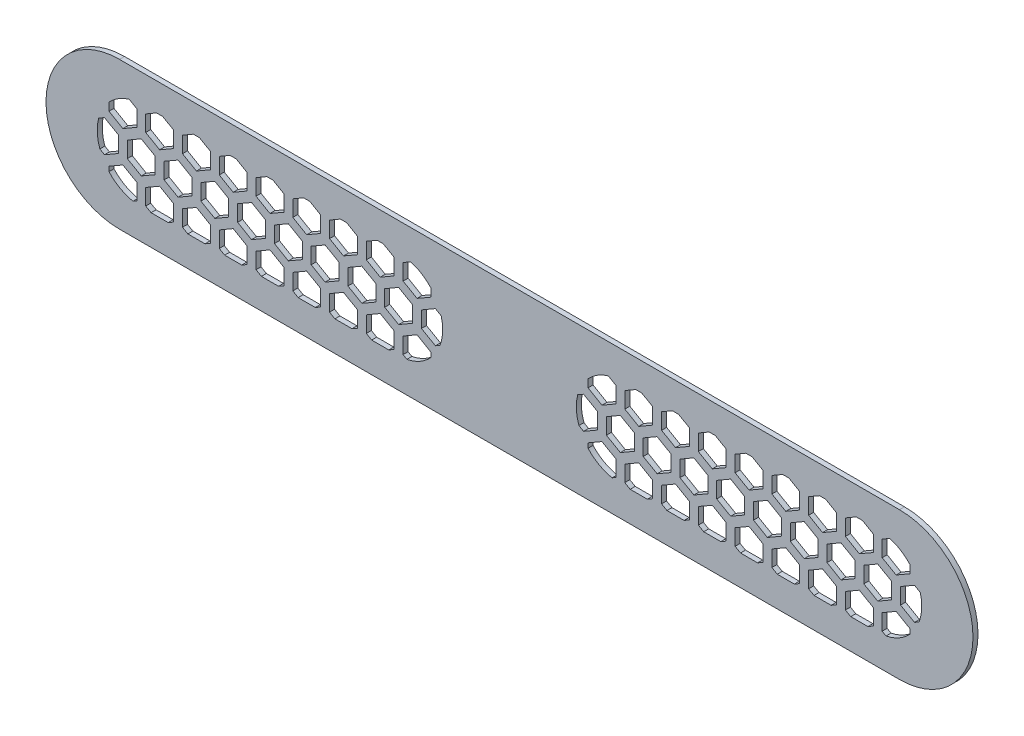
from build123d import *

# Parameters (mm, degrees)
AUFSATZ_LINEAR_AUSTRAGEN1_DEPTH    = 0.45
K_RPER_VERSCHIEBEN_KOPIEREN1_DEPTH = 0.45
SCHNITT_LINEAR_AUSTRAGEN1_DEPTH    = 51.428290671
LINEARES_MUSTER1_COUNT             = 13
LINEARES_MUSTER1_PITCH             = 3.3
LINEARES_MUSTER1_COUNT_DIR2        = 11
LINEARES_MUSTER1_PITCH_DIR2        = 3.3
SKIZZE4_OUTSIDE_W                  = 52.33
SKIZZE4_OUTSIDE_H                  = 23.93
SCHNITT_LINEAR_AUSTRAGEN2_DEPTH    = 51.428290671
SCHNITT_LINEAR_AUSTRAGEN3_DEPTH    = 51.428290671


# Read off the part's stored shape, not the designer's step: Körper-Verschieben/Kopieren1
with BuildPart() as part:
    # Skizze2 → Aufsatz-Linear austragen1 (new body)
    with BuildSketch(Plane.XY):
        with BuildLine():
            Line((0, 15.3), (35, 15.3))
            ThreePointArc((35, 15.3), (41.6, 21.9), (35, 28.5))
            Line((35, 28.5), (0, 28.5))
            Line((0, 28.5), (0, 15.3))
        make_face()
    extrude(amount=AUFSATZ_LINEAR_AUSTRAGEN1_DEPTH)

    # Skizze3 → Schnitt-Linear austragen1 (cut, through all)
    with BuildSketch(Plane.XY):
        Polygon((5, 20.443375673), (3.75, 19.721687836), (3.75, 18.278312164), (5, 17.556624327), (6.25, 18.278312164), (6.25, 19.721687836), align=None)
    schnitt_linear_austragen1 = extrude(amount=SCHNITT_LINEAR_AUSTRAGEN1_DEPTH, mode=Mode.SUBTRACT)

    # Lineares Muster1: Schnitt-Linear austragen1 13 × 11
    with Locations(*[Vector(0.49999999999999906, 0.8660254037844393, 0) * (i * LINEARES_MUSTER1_PITCH) + Vector(0.5000000000000003, -0.8660254037844386, 0) * (j * LINEARES_MUSTER1_PITCH_DIR2) for i in range(LINEARES_MUSTER1_COUNT) for j in range(LINEARES_MUSTER1_COUNT_DIR2) if (i, j) != (0, 0)]):
        add(schnitt_linear_austragen1, mode=Mode.SUBTRACT)

    # Skizze4 outside → Schnitt-Linear austragen2 (cut, through all)
    with BuildSketch(Plane.XY):
        with Locations((20.8, 21.9)):
            Rectangle(SKIZZE4_OUTSIDE_W, SKIZZE4_OUTSIDE_H)
        with BuildLine():
            Line((33, 18), (10, 18))
            ThreePointArc((10, 18), (6, 22), (10, 26))
            Line((10, 26), (33, 26))
            ThreePointArc((33, 26), (37, 22), (33, 18))
        make_face(mode=Mode.SUBTRACT)
    extrude(amount=SCHNITT_LINEAR_AUSTRAGEN2_DEPTH, mode=Mode.SUBTRACT)


with BuildPart() as body_2:
    # Körper-Verschieben/Kopieren1 outline → Körper-Verschieben/Kopieren1 (new body)
    with BuildSketch(Plane.XY):
        with BuildLine():
            Line((35, 28.5), (0, 28.5))
            Line((0, 28.5), (0, 15.3))
            Line((0, 15.3), (35, 15.3))
            ThreePointArc((35, 15.3), (41.6, 21.9), (35, 28.5))
        make_face()
    extrude(amount=K_RPER_VERSCHIEBEN_KOPIEREN1_DEPTH)

    # Skizze4<2> → Schnitt-Linear austragen3 (cut, through all)
    with BuildSketch(Plane.XY):
        with BuildLine():
            Line((33, 18), (10, 18))
            ThreePointArc((10, 18), (6, 22), (10, 26))
            Line((10, 26), (33, 26))
            ThreePointArc((33, 26), (37, 22), (33, 18))
        make_face()
    extrude(amount=SCHNITT_LINEAR_AUSTRAGEN3_DEPTH, mode=Mode.SUBTRACT)


with BuildPart() as part_1:
    add(part.part)

    # Kombinieren1: union body 2
    add(body_2.part)

    # Spiegeln2: part across plane


with BuildPart() as part_2:
    add(part_1.part)
    add(part_1.part.mirror(Plane(origin=(0, 0, 0), x_dir=(0, 0, 1), z_dir=(1, 0, 0))))


solid = part_2.part
